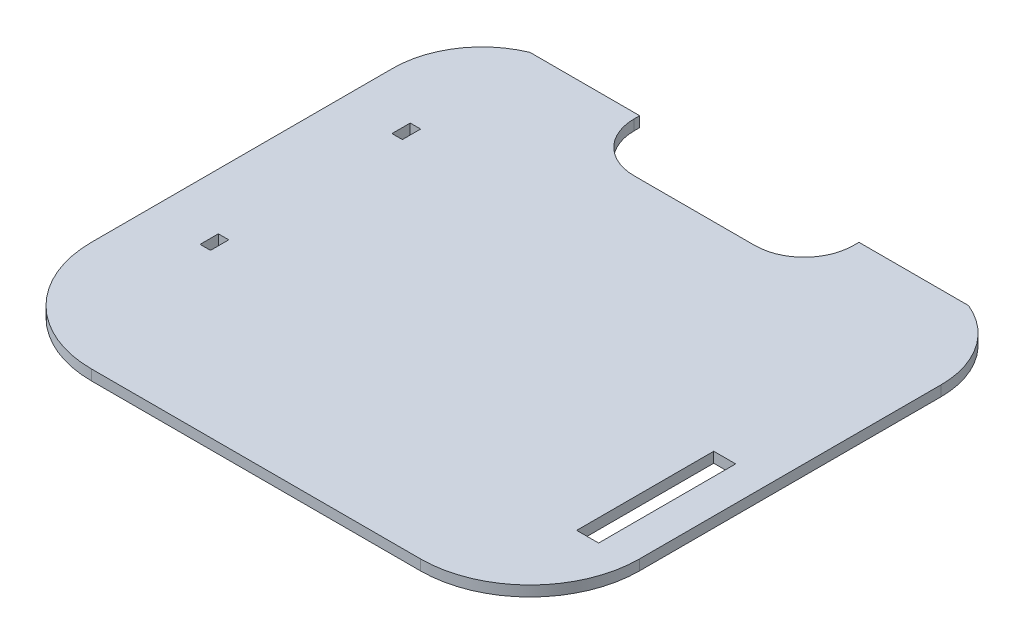
from build123d import *

# Parameters (mm, degrees)
SKETCH1_W           = 254
SKETCH1_H           = 228.6
BOSS_EXTRUDE1_DEPTH = 4.826
CUT_EXTRUDE3_DEPTH  = 4.826
SKETCH7_W           = 101.6
SKETCH7_H           = 25.4
CUT_EXTRUDE5_DEPTH  = 4.826
FILLET9_R           = 22.86
FILLET10_R          = 22.86
SKETCH19_W          = 4.826
SKETCH19_H          = 8.466666666
CUT_EXTRUDE16_DEPTH = 171.929167423
FILLET11_R          = 50.8
SKETCH20_W          = 10.16
SKETCH20_H          = 63.5
CUT_EXTRUDE17_DEPTH = 171.929167423


with BuildPart() as part:
    # Sketch1 → Boss-Extrude1 (new body)
    with BuildSketch(Plane(origin=(0, 0, 0), x_dir=(1, 0, 0), z_dir=(0, 1, 0))):
        Rectangle(SKETCH1_W, SKETCH1_H)
    extrude(amount=BOSS_EXTRUDE1_DEPTH)

    # Sketch4 → Cut-Extrude3 (cut)
    with BuildSketch(Plane(origin=(0, 4.826, 0), x_dir=(1, 0, 0), z_dir=(0, 1, 0))):
        with BuildLine():
            Line((-127, 76.2), (-127, 114.3))
            Line((-127, 114.3), (-101.6, 114.3))
            ThreePointArc((-101.6, 114.3), (-120.067875899, 99.095250599), (-127, 76.2))
        make_face()
        with BuildLine():
            Line((127, 76.2), (127, 114.3))
            Line((127, 114.3), (101.6, 114.3))
            ThreePointArc((101.6, 114.3), (120.067875899, 99.095250599), (127, 76.2))
        make_face()
    extrude(amount=-CUT_EXTRUDE3_DEPTH, mode=Mode.SUBTRACT)

    # Sketch7 → Cut-Extrude5 (cut)
    with BuildSketch(Plane(origin=(0, 4.826, 0), x_dir=(1, 0, 0), z_dir=(0, 1, 0))):
        with Locations((0, 101.6)):
            Rectangle(SKETCH7_W, SKETCH7_H)
    extrude(amount=-CUT_EXTRUDE5_DEPTH, mode=Mode.SUBTRACT)

    # Fillet9
    fillet9_edges = [part.edges().sort_by_distance(p)[0] for p in [
        (-50.8, 2.413, -88.9),
    ]]
    fillet(fillet9_edges, radius=FILLET9_R)

    # Fillet10
    fillet10_edges = [part.edges().sort_by_distance(p)[0] for p in [
        (50.8, 2.413, -88.9),
    ]]
    fillet(fillet10_edges, radius=FILLET10_R)

    # Sketch19 → Cut-Extrude16 (cut, through all)
    with BuildSketch(Plane(origin=(0, 4.826, 0), x_dir=(1, 0, 0), z_dir=(0, 1, 0))):
        with Locations((-98.58699993, -34.925)):
            Rectangle(SKETCH19_W, SKETCH19_H)
        with Locations((-98.58699993, 53.975)):
            Rectangle(SKETCH19_W, SKETCH19_H)
    extrude(amount=-CUT_EXTRUDE16_DEPTH, mode=Mode.SUBTRACT)

    # Fillet11
    fillet11_edges = [part.edges().sort_by_distance(p)[0] for p in [
        (-127, 2.413, 114.3),
        (127, 2.413, 114.3),
    ]]
    fillet(fillet11_edges, radius=FILLET11_R)

    # Sketch20 → Cut-Extrude17 (cut, through all)
    with BuildSketch(Plane.XZ):
        with Locations((106.07999993, 34.925)):
            Rectangle(SKETCH20_W, SKETCH20_H)
    extrude(amount=-CUT_EXTRUDE17_DEPTH, mode=Mode.SUBTRACT)


solid = part.part
